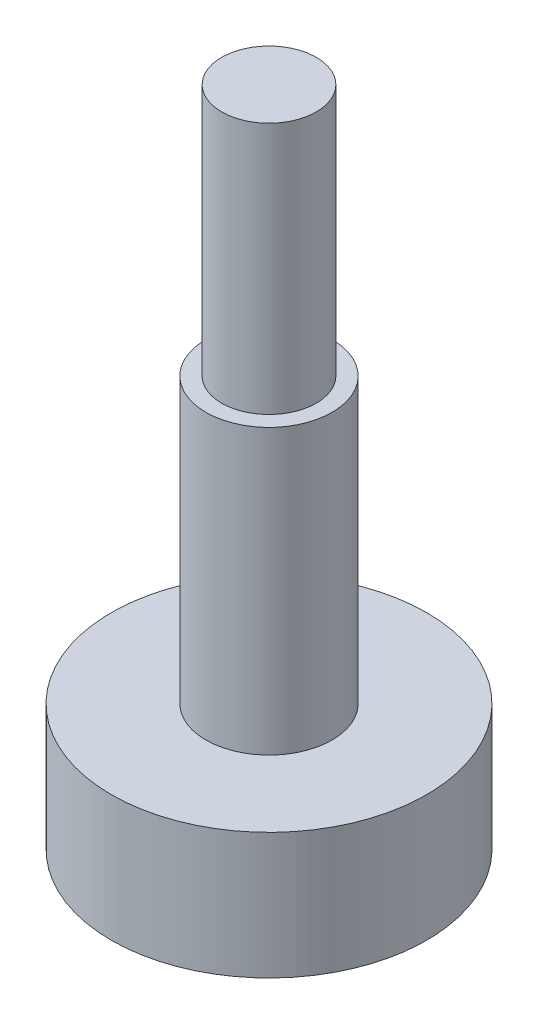
from build123d import *

# Parameters (mm, degrees)
CUT_EXTRUDE1_DEPTH = 2


with BuildPart() as part:
    # Sketch1 → Revolve1 (revolve)
    with BuildSketch(Plane.XY):
        Polygon((0, 0), (5, 0), (5, 4), (2, 4), (2, 13), (1.5, 13), (1.5, 21), (0, 21), align=None)
    revolve(axis=Axis((0, 21, 0), (0, -1, 0)))

    # Sketch2 → Cut-Extrude1 (cut)
    with BuildSketch(Plane.XZ):
        Polygon((0, -1.732050808), (1.5, -0.866025404), (1.5, 0.866025404), (0, 1.732050808), (-1.5, 0.866025404), (-1.5, -0.866025404), align=None)
    extrude(amount=-CUT_EXTRUDE1_DEPTH, mode=Mode.SUBTRACT)


solid = part.part
